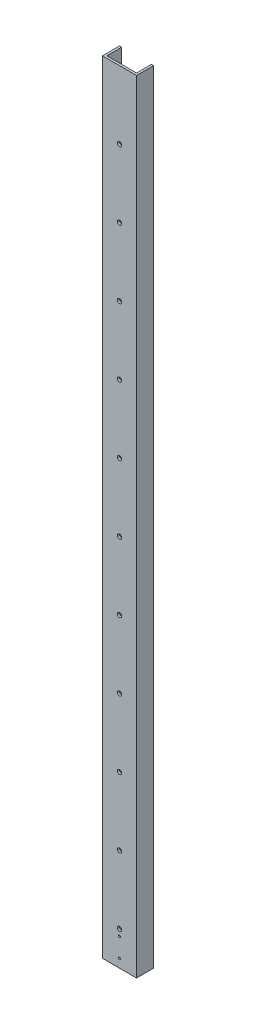
from build123d import *

# Parameters (mm, degrees)
BOSS_EXTRUDE1_DEPTH = 1168.4
CUT_EXTRUDE1_REACH  = 1171.78
SKETCH2_R           = 3.175
CUT_EXTRUDE2_REACH  = 1171.78
SKETCH4_R           = 1.5875


with BuildPart() as part:
    # Sketch1 → Boss-Extrude1 (new body)
    with BuildSketch(Plane(origin=(0, 0, 0), x_dir=(1, 0, 0), z_dir=(0, 1, 0))):
        Polygon((3.175, 3.175), (3.175, 25.4), (0, 25.4), (0, 0), (50.8, 0), (50.8, 25.4), (47.625, 25.4), (47.625, 3.175), align=None)
    extrude(amount=BOSS_EXTRUDE1_DEPTH)

    # Sketch2 → Cut-Extrude1 (cut, up to next)
    with BuildSketch(Plane.XY, mode=Mode.PRIVATE) as cut_extrude1_sk1:
        with Locations((25.4, 50.8)):
            Circle(SKETCH2_R)
    cut_extrude1_tool1 = extrude(cut_extrude1_sk1.sketch, amount=-CUT_EXTRUDE1_REACH, mode=Mode.PRIVATE) & part.part
    # Sketch2 → Cut-Extrude1 (cut, up to next)
    with BuildSketch(Plane.XY, mode=Mode.PRIVATE) as cut_extrude1_sk2:
        with Locations((25.4, 152.4)):
            Circle(SKETCH2_R)
    cut_extrude1_tool2 = extrude(cut_extrude1_sk2.sketch, amount=-CUT_EXTRUDE1_REACH, mode=Mode.PRIVATE) & part.part
    # Sketch2 → Cut-Extrude1 (cut, up to next)
    with BuildSketch(Plane.XY, mode=Mode.PRIVATE) as cut_extrude1_sk3:
        with Locations((25.4, 254)):
            Circle(SKETCH2_R)
    cut_extrude1_tool3 = extrude(cut_extrude1_sk3.sketch, amount=-CUT_EXTRUDE1_REACH, mode=Mode.PRIVATE) & part.part
    # Sketch2 → Cut-Extrude1 (cut, up to next)
    with BuildSketch(Plane.XY, mode=Mode.PRIVATE) as cut_extrude1_sk4:
        with Locations((25.4, 355.6)):
            Circle(SKETCH2_R)
    cut_extrude1_tool4 = extrude(cut_extrude1_sk4.sketch, amount=-CUT_EXTRUDE1_REACH, mode=Mode.PRIVATE) & part.part
    # Sketch2 → Cut-Extrude1 (cut, up to next)
    with BuildSketch(Plane.XY, mode=Mode.PRIVATE) as cut_extrude1_sk5:
        with Locations((25.4, 457.2)):
            Circle(SKETCH2_R)
    cut_extrude1_tool5 = extrude(cut_extrude1_sk5.sketch, amount=-CUT_EXTRUDE1_REACH, mode=Mode.PRIVATE) & part.part
    # Sketch2 → Cut-Extrude1 (cut, up to next)
    with BuildSketch(Plane.XY, mode=Mode.PRIVATE) as cut_extrude1_sk6:
        with Locations((25.4, 558.8)):
            Circle(SKETCH2_R)
    cut_extrude1_tool6 = extrude(cut_extrude1_sk6.sketch, amount=-CUT_EXTRUDE1_REACH, mode=Mode.PRIVATE) & part.part
    # Sketch2 → Cut-Extrude1 (cut, up to next)
    with BuildSketch(Plane.XY, mode=Mode.PRIVATE) as cut_extrude1_sk7:
        with Locations((25.4, 660.4)):
            Circle(SKETCH2_R)
    cut_extrude1_tool7 = extrude(cut_extrude1_sk7.sketch, amount=-CUT_EXTRUDE1_REACH, mode=Mode.PRIVATE) & part.part
    # Sketch2 → Cut-Extrude1 (cut, up to next)
    with BuildSketch(Plane.XY, mode=Mode.PRIVATE) as cut_extrude1_sk8:
        with Locations((25.4, 762)):
            Circle(SKETCH2_R)
    cut_extrude1_tool8 = extrude(cut_extrude1_sk8.sketch, amount=-CUT_EXTRUDE1_REACH, mode=Mode.PRIVATE) & part.part
    # Sketch2 → Cut-Extrude1 (cut, up to next)
    with BuildSketch(Plane.XY, mode=Mode.PRIVATE) as cut_extrude1_sk9:
        with Locations((25.4, 863.6)):
            Circle(SKETCH2_R)
    cut_extrude1_tool9 = extrude(cut_extrude1_sk9.sketch, amount=-CUT_EXTRUDE1_REACH, mode=Mode.PRIVATE) & part.part
    # Sketch2 → Cut-Extrude1 (cut, up to next)
    with BuildSketch(Plane.XY, mode=Mode.PRIVATE) as cut_extrude1_sk10:
        with Locations((25.4, 965.2)):
            Circle(SKETCH2_R)
    cut_extrude1_tool10 = extrude(cut_extrude1_sk10.sketch, amount=-CUT_EXTRUDE1_REACH, mode=Mode.PRIVATE) & part.part
    # Sketch2 → Cut-Extrude1 (cut, up to next)
    with BuildSketch(Plane.XY, mode=Mode.PRIVATE) as cut_extrude1_sk11:
        with Locations((25.4, 1066.8)):
            Circle(SKETCH2_R)
    cut_extrude1_tool11 = extrude(cut_extrude1_sk11.sketch, amount=-CUT_EXTRUDE1_REACH, mode=Mode.PRIVATE) & part.part
    add(cut_extrude1_tool1.solids().sort_by_distance((25.4, 50.8, 0))[0], mode=Mode.SUBTRACT)
    add(cut_extrude1_tool2.solids().sort_by_distance((25.4, 152.4, 0))[0], mode=Mode.SUBTRACT)
    add(cut_extrude1_tool3.solids().sort_by_distance((25.4, 254, 0))[0], mode=Mode.SUBTRACT)
    add(cut_extrude1_tool4.solids().sort_by_distance((25.4, 355.6, 0))[0], mode=Mode.SUBTRACT)
    add(cut_extrude1_tool5.solids().sort_by_distance((25.4, 457.2, 0))[0], mode=Mode.SUBTRACT)
    add(cut_extrude1_tool6.solids().sort_by_distance((25.4, 558.8, 0))[0], mode=Mode.SUBTRACT)
    add(cut_extrude1_tool7.solids().sort_by_distance((25.4, 660.4, 0))[0], mode=Mode.SUBTRACT)
    add(cut_extrude1_tool8.solids().sort_by_distance((25.4, 762, 0))[0], mode=Mode.SUBTRACT)
    add(cut_extrude1_tool9.solids().sort_by_distance((25.4, 863.6, 0))[0], mode=Mode.SUBTRACT)
    add(cut_extrude1_tool10.solids().sort_by_distance((25.4, 965.2, 0))[0], mode=Mode.SUBTRACT)
    add(cut_extrude1_tool11.solids().sort_by_distance((25.4, 1066.8, 0))[0], mode=Mode.SUBTRACT)

    # Sketch4 → Cut-Extrude2 (cut, up to next)
    with BuildSketch(Plane.XY, mode=Mode.PRIVATE) as cut_extrude2_sk1:
        with Locations((25.4, 41.275)):
            Circle(SKETCH4_R)
    cut_extrude2_tool1 = extrude(cut_extrude2_sk1.sketch, amount=-CUT_EXTRUDE2_REACH, mode=Mode.PRIVATE) & part.part
    # Sketch4 → Cut-Extrude2 (cut, up to next)
    with BuildSketch(Plane.XY, mode=Mode.PRIVATE) as cut_extrude2_sk2:
        with Locations((25.4, 12.7)):
            Circle(SKETCH4_R)
    cut_extrude2_tool2 = extrude(cut_extrude2_sk2.sketch, amount=-CUT_EXTRUDE2_REACH, mode=Mode.PRIVATE) & part.part
    add(cut_extrude2_tool1.solids().sort_by_distance((25.4, 41.275, 0))[0], mode=Mode.SUBTRACT)
    add(cut_extrude2_tool2.solids().sort_by_distance((25.4, 12.7, 0))[0], mode=Mode.SUBTRACT)


solid = part.part
